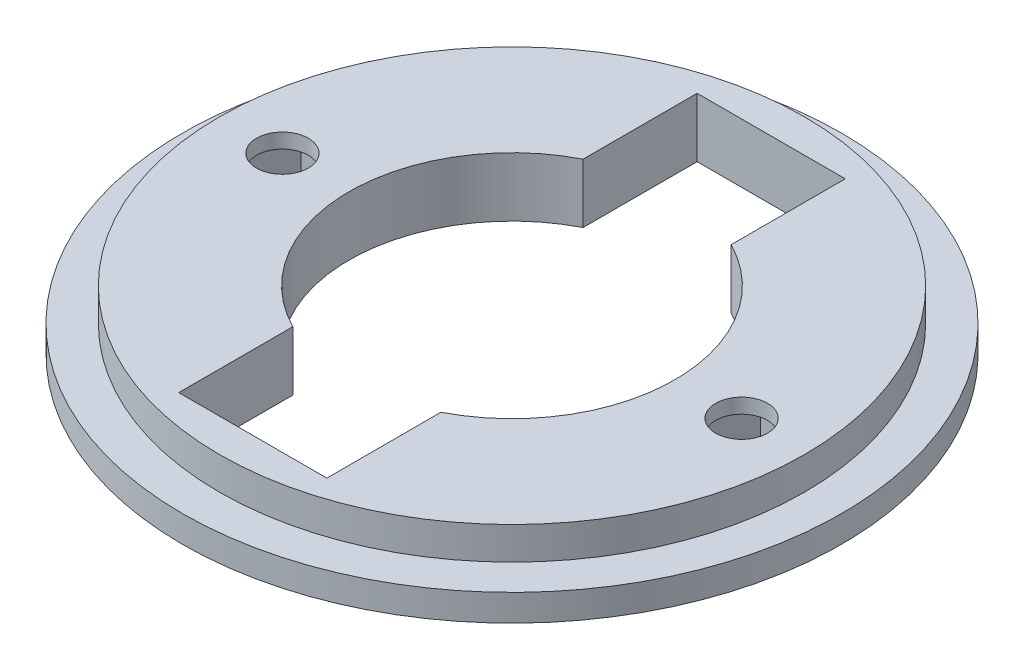
from build123d import *

# Parameters (mm, degrees)
SKETCH1_R           = 22.25
BOSS_EXTRUDE2_DEPTH = 4
CUT_EXTRUDE1_START  = -2.2
SKETCH2_R           = 22.25
SKETCH2_R_2         = 19.75
CUT_EXTRUDE1_DEPTH  = 2.2
CUT_EXTRUDE2_DEPTH  = 32.719473514
SKETCH4_R           = 1.75
CUT_EXTRUDE3_DEPTH  = 32.719473514
CUT_EXTRUDE4_DEPTH  = 3


with BuildPart() as part:
    # Sketch1 → Boss-Extrude2 (new body)
    with BuildSketch(Plane(origin=(0, 0, 0), x_dir=(1, 0, 0), z_dir=(0, 1, 0))):
        Circle(SKETCH1_R)
    extrude(amount=BOSS_EXTRUDE2_DEPTH)

    # Sketch2 → Cut-Extrude1 (cut)
    with BuildSketch(Plane(origin=(0, 4, 0), x_dir=(1, 0, 0), z_dir=(0, 1, 0)).offset(CUT_EXTRUDE1_START)):
        Circle(SKETCH2_R)
        Circle(SKETCH2_R_2, mode=Mode.SUBTRACT)
    extrude(amount=CUT_EXTRUDE1_DEPTH, mode=Mode.SUBTRACT)

    # Sketch3 → Cut-Extrude2 (cut, through all)
    with BuildSketch(Plane(origin=(0, 4, 0), x_dir=(1, 0, 0), z_dir=(0, 1, 0))):
        with BuildLine():
            Line((5, -9.797958971), (5, -17.5))
            Line((5, -17.5), (-5, -17.5))
            Line((-5, -17.5), (-5, -9.797958971))
            ThreePointArc((-5, -9.797958971), (-11, 0), (-5, 9.797958971))
            Line((-5, 9.797958971), (-5, 17.5))
            Line((-5, 17.5), (5, 17.5))
            Line((5, 17.5), (5, 9.797958971))
            ThreePointArc((5, 9.797958971), (11, 0), (5, -9.797958971))
        make_face()
    extrude(amount=-CUT_EXTRUDE2_DEPTH, mode=Mode.SUBTRACT)

    # Sketch4 → Cut-Extrude3 (cut, through all)
    with BuildSketch(Plane(origin=(0, 4, 0), x_dir=(1, 0, 0), z_dir=(0, 1, 0))):
        with Locations((15.5, 0)):
            Circle(SKETCH4_R)
        with Locations((-15.5, 0)):
            Circle(SKETCH4_R)
    extrude(amount=-CUT_EXTRUDE3_DEPTH, mode=Mode.SUBTRACT)

    # Sketch5 → Cut-Extrude4 (cut)
    with BuildSketch(Plane.XZ):
        Polygon((13.767949192, -3), (12.035898385, 0), (13.767949192, 3), (17.232050808, 3), (18.964101615, 0), (17.232050808, -3), align=None)
        Polygon((-12.035898385, 0), (-13.767949192, 3), (-17.232050808, 3), (-18.964101615, 0), (-17.232050808, -3), (-13.767949192, -3), align=None)
    extrude(amount=-CUT_EXTRUDE4_DEPTH, mode=Mode.SUBTRACT)


solid = part.part
